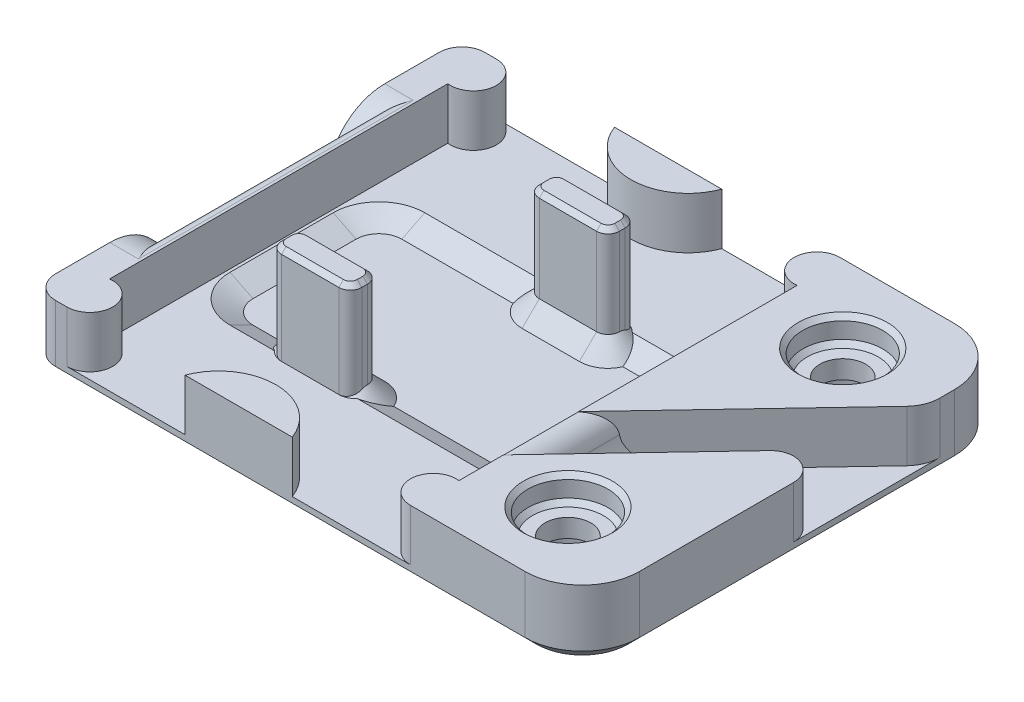
from build123d import *
from OCP.BRepFilletAPI import BRepFilletAPI_MakeChamfer

# Parameters (mm, degrees)
SKETCH2_W                       = 48
SKETCH2_H                       = 37.5
BOSS_EXTRUDE1_DEPTH             = 1.5
BOSS_EXTRUDE2_DEPTH             = 4.5
SKETCH4_W                       = 1.5
SKETCH4_H                       = 14
CUT_EXTRUDE1_DEPTH              = 36.882621142
SKETCH5_W                       = 14
SKETCH5_H                       = 1.349353752
CUT_EXTRUDE2_DEPTH              = 1
SKETCH6_R                       = 2
CUT_EXTRUDE3_DEPTH              = 36.882621142
FILLET1_R                       = 5
FILLET2_R                       = 2
FILLET3_R                       = 3
SKETCH7_W                       = 26
SKETCH7_H                       = 13
CUT_EXTRUDE4_DEPTH              = 1
FILLET4_R                       = 2
CHAMFER1_SIZE                   = 2
CHAMFER1_SIZE_2                 = 1
FILLET5_R                       = 1
CHAMFER3_SIZE                   = 1
BOSS_EXTRUDE3_REACH             = 37.883
SKETCH8_W                       = 7
SKETCH8_H                       = 2.5
BOSS_EXTRUDE3_DIRECTION_2_DEPTH = 4
FILLET6_R                       = 1
CHAMFER5_SIZE                   = 0.4
SKETCH9_R                       = 3.5
CUT_EXTRUDE5_DEPTH              = 2.2
CHAMFER6_SIZE                   = 0.4
SKETCH10_R                      = 4.5
CUT_EXTRUDE6_DEPTH              = 2.2


with BuildPart() as part:
    # Sketch2 → Boss-Extrude1 (new body)
    with BuildSketch(Plane(origin=(0, 0, 0), x_dir=(1, 0, 0), z_dir=(0, 1, 0))):
        with Locations((6, 0)):
            Rectangle(SKETCH2_W, SKETCH2_H)
    extrude(amount=-BOSS_EXTRUDE1_DEPTH)

    # Sketch3 → Boss-Extrude2 (add)
    with BuildSketch(Plane(origin=(0, 0, 0), x_dir=(1, 0, 0), z_dir=(0, 1, 0))):
        with BuildLine():
            Line((-4.683748499, -18.75), (4.683748499, -18.75))
            ThreePointArc((4.683748499, -18.75), (0, -15.5), (-4.683748499, -18.75))
        make_face()
        with BuildLine():
            Line((-18, 18.75), (-15, 18.75))
            ThreePointArc((-15, 18.75), (-13.003925482, 16.624754175), (-15.25, 14.765686517))
            Line((-15.25, 14.765686517), (-15.25, -14.765686517))
            ThreePointArc((-15.25, -14.765686517), (-13.003925482, -16.624754175), (-15, -18.75))
            Line((-15, -18.75), (-18, -18.75))
            Line((-18, -18.75), (-18, 18.75))
        make_face()
        with BuildLine():
            Line((15.25, 14.765686517), (15.25, -14.765686517))
            ThreePointArc((15.25, -14.765686517), (13.003925482, -16.624754175), (15, -18.75))
            Line((15, -18.75), (30, -18.75))
            Line((30, -18.75), (30, 4.724945092))
            Line((30, 4.724945092), (17, -9.025054908))
            Line((17, -9.025054908), (17, -2.474945092))
            Line((17, -2.474945092), (30, 11.275054908))
            Line((30, 11.275054908), (30, 18.75))
            Line((30, 18.75), (15, 18.75))
            ThreePointArc((15, 18.75), (13.003925482, 16.624754175), (15.25, 14.765686517))
        make_face()
        with BuildLine():
            Line((-4.683748499, 18.75), (4.683748499, 18.75))
            ThreePointArc((4.683748499, 18.75), (0, 15.5), (-4.683748499, 18.75))
        make_face()
    extrude(amount=BOSS_EXTRUDE2_DEPTH)

    # Sketch4 → Cut-Extrude1 (cut, through all)
    with BuildSketch(Plane(origin=(0, 4.5, 0), x_dir=(1, 0, 0), z_dir=(0, 1, 0))):
        with Locations((-17.25, 0)):
            Rectangle(SKETCH4_W, SKETCH4_H)
    extrude(amount=-CUT_EXTRUDE1_DEPTH, mode=Mode.SUBTRACT)

    # Sketch5 → Cut-Extrude2 (cut)
    with BuildSketch(Plane.ZY.offset(16.5)):
        with Locations((0, -0.825323124)):
            Rectangle(SKETCH5_W, SKETCH5_H)
    extrude(amount=-CUT_EXTRUDE2_DEPTH, mode=Mode.SUBTRACT)

    # Sketch6 → Cut-Extrude3 (cut, through all)
    with BuildSketch(Plane(origin=(0, 4.5, 0), x_dir=(1, 0, 0), z_dir=(0, 1, 0))):
        with Locations(Location((22, 12, 0), (0, 0, 270))):
            Circle(SKETCH6_R)
        with Locations(Location((22, -12, 0), (0, 0, 270))):
            Circle(SKETCH6_R)
    extrude(amount=-CUT_EXTRUDE3_DEPTH, mode=Mode.SUBTRACT)

    # Fillet1
    # the kernel refuses this fillet: 5 mm, written as the material it takes off along each edge
    with BuildSketch(Plane(origin=(-16.5, 4.5, 7), x_dir=(0, 0, 1), z_dir=(-1, 0, 0)), Plane(origin=(-30.5, 4.5, -7), x_dir=(0, 0, -1), z_dir=(1, 0, 0))) as fillet1_piece_1:
        with BuildLine():
            CenterArc((FILLET1_R, -FILLET1_R), FILLET1_R, 90, 90)
            Line((0, -FILLET1_R), (0, 0))
            Line((0, 0), (FILLET1_R, 0))
        make_face()
    extrude(amount=14, mode=Mode.SUBTRACT)
    with BuildSketch(Plane(origin=(-4, 4.5, 7), x_dir=(0, 0, 1), z_dir=(-1, 0, 0))) as fillet1_piece_2_section:
        with BuildLine():
            CenterArc((FILLET1_R, -FILLET1_R), FILLET1_R, 90, 90)
            Line((0, -FILLET1_R), (0, 0))
            Line((0, 0), (FILLET1_R, 0))
        make_face()
    fillet1_piece_2 = extrude(amount=26.5, mode=Mode.PRIVATE)
    fillet1_piece_2 = split(fillet1_piece_2, bisect_by=Plane(origin=(-15.5, 4.5, 7), z_dir=(-1, 0, 0)), keep=Keep.TOP, mode=Mode.PRIVATE)
    fillet1_piece_2 = split(fillet1_piece_2, bisect_by=Plane(origin=(-4, -0.150646248, 7), z_dir=(0, -1, 0)), keep=Keep.TOP, mode=Mode.PRIVATE)
    add(fillet1_piece_2, mode=Mode.SUBTRACT)
    with BuildSketch(Plane(origin=(30, 17, -18.75), x_dir=(-1, 0, 0), z_dir=(0, -1, 0)), Plane(origin=(30, 17, 18.75), x_dir=(0, 0, -1), z_dir=(0, -1, 0))) as fillet1_piece_3:
        with BuildLine():
            CenterArc((FILLET1_R, -FILLET1_R), FILLET1_R, 90, 90)
            Line((0, -FILLET1_R), (0, 0))
            Line((0, 0), (FILLET1_R, 0))
        make_face()
    extrude(amount=31, mode=Mode.SUBTRACT)
    with BuildSketch(Plane(origin=(-30.5, 4.5, -7), x_dir=(0, 0, -1), z_dir=(1, 0, 0))) as fillet1_piece_4_section:
        with BuildLine():
            CenterArc((FILLET1_R, -FILLET1_R), FILLET1_R, 90, 90)
            Line((0, -FILLET1_R), (0, 0))
            Line((0, 0), (FILLET1_R, 0))
        make_face()
    fillet1_piece_4 = extrude(amount=26.5, mode=Mode.PRIVATE)
    fillet1_piece_4 = split(fillet1_piece_4, bisect_by=Plane(origin=(-15.5, 4.5, -7), z_dir=(-1, 0, 0)), keep=Keep.TOP, mode=Mode.PRIVATE)
    fillet1_piece_4 = split(fillet1_piece_4, bisect_by=Plane(origin=(-30.5, -0.150646248, -7), z_dir=(0, -1, 0)), keep=Keep.TOP, mode=Mode.PRIVATE)
    add(fillet1_piece_4, mode=Mode.SUBTRACT)

    # Fillet2
    # the kernel refuses this fillet: 2 mm, written as the material it takes off along each edge
    with BuildSketch(Plane(origin=(30, 0, -4.724945092), x_dir=(0, 0, 1), z_dir=(0, 1, 0))) as fillet2_piece_1:
        with BuildLine():
            CenterArc((FILLET2_R * 2.51327226694, -FILLET2_R), FILLET2_R, 90, 136.606002989)
            Line((FILLET2_R * 1.82626088453, -FILLET2_R * 1.72664665447), (0, 0))
            Line((0, 0), (FILLET2_R * 2.51327226694, 0))
        make_face()
    extrude(amount=17.066361335, mode=Mode.SUBTRACT)
    with BuildSketch(Plane(origin=(17, 4.5, 14.025054908), x_dir=(0, -1, 0), z_dir=(0, 0, -1))) as fillet2_piece_2_section:
        with BuildLine():
            CenterArc((FILLET2_R, FILLET2_R), FILLET2_R, 180, 90)
            Line((0, FILLET2_R), (0, 0))
            Line((0, 0), (FILLET2_R, 0))
        make_face()
    fillet2_piece_2 = extrude(amount=16.550109817, mode=Mode.PRIVATE)
    fillet2_piece_2 = split(fillet2_piece_2, bisect_by=Plane(origin=(14.503927387, 4.5, 11.665131711), z_dir=(-0.7266466544661552, 0, -0.687011382404356)), keep=Keep.TOP, mode=Mode.PRIVATE)
    fillet2_piece_2 = split(fillet2_piece_2, bisect_by=Plane(origin=(11.234017442, 4.5, 8.57358049), z_dir=(0.7266466544661551, 0, 0.687011382404356)), keep=Keep.TOP, mode=Mode.PRIVATE)
    add(fillet2_piece_2, mode=Mode.SUBTRACT)
    with BuildSketch(Plane(origin=(-18, -6.5, -18.75), x_dir=(1, 0, 0), z_dir=(0, 1, 0))) as fillet2_piece_3:
        with BuildLine():
            CenterArc((FILLET2_R, -FILLET2_R), FILLET2_R, 90, 90)
            Line((0, -FILLET2_R), (0, 0))
            Line((0, 0), (FILLET2_R, 0))
        make_face()
    extrude(amount=16, mode=Mode.SUBTRACT)
    with BuildSketch(Plane(origin=(-18, -6.5, 18.75), x_dir=(1, 0, 0), z_dir=(0, 1, 0))) as fillet2_piece_4:
        with BuildLine():
            CenterArc((FILLET2_R, FILLET2_R), FILLET2_R, 180, 90)
            Line((0, FILLET2_R), (0, 0))
            Line((0, 0), (FILLET2_R, 0))
        make_face()
    extrude(amount=16, mode=Mode.SUBTRACT)

    # Fillet3
    fillet3_edges = [part.edges().sort_by_distance(p)[0] for p in [
        (17, 0, 5.75),
        (30, 2.25, -11.275054908),
    ]]
    fillet(fillet3_edges, radius=FILLET3_R)

    # Sketch7 → Cut-Extrude4 (cut)
    with BuildSketch(Plane(origin=(0, 0, 0), x_dir=(1, 0, 0), z_dir=(0, 1, 0))):
        Rectangle(SKETCH7_W, SKETCH7_H)
    extrude(amount=-CUT_EXTRUDE4_DEPTH, mode=Mode.SUBTRACT)

    # Fillet4
    fillet4_edges = [part.edges().sort_by_distance(p)[0] for p in [
        (-13, -0.5, 6.5),
        (-13, -0.5, -6.5),
        (13, -0.5, -6.5),
        (13, -0.5, 6.5),
    ]]
    fillet(fillet4_edges, radius=FILLET4_R)

    # Chamfer1
    chamfer1_edges_1 = [part.edges().sort_by_distance(p)[0] for p in [
        (12.414213562, 0, 5.914213562),
    ]]
    chamfer1_side_1 = [part.faces().sort_by_distance(p)[0] for p in [
        (12.428355698, 0, 5.928355698),
    ]]
    chamfer1_edges_2 = [part.edges().sort_by_distance(p)[0] for p in [
        (13, 0, 0),
    ]]
    chamfer1_side_2 = [part.faces().sort_by_distance(p)[0] for p in [
        (13.02, 0, 0),
    ]]
    chamfer1_edges_3 = [part.edges().sort_by_distance(p)[0] for p in [
        (12.414213562, 0, -5.914213562),
    ]]
    chamfer1_side_3 = [part.faces().sort_by_distance(p)[0] for p in [
        (12.428355698, 0, -5.928355698),
    ]]
    chamfer1_edges_4 = [part.edges().sort_by_distance(p)[0] for p in [
        (-12.414213562, 0, 5.914213562),
    ]]
    chamfer1_side_4 = [part.faces().sort_by_distance(p)[0] for p in [
        (-12.428355698, 0, 5.928355698),
    ]]
    chamfer1_edges_5 = [part.edges().sort_by_distance(p)[0] for p in [
        (-13, 0, 0),
    ]]
    chamfer1_side_5 = [part.faces().sort_by_distance(p)[0] for p in [
        (-13.02, 0, 0),
    ]]
    chamfer1_edges_6 = [part.edges().sort_by_distance(p)[0] for p in [
        (-12.414213562, 0, -5.914213562),
    ]]
    chamfer1_side_6 = [part.faces().sort_by_distance(p)[0] for p in [
        (-12.428355698, 0, -5.928355698),
    ]]
    chamfer1_edges_7 = [part.edges().sort_by_distance(p)[0] for p in [
        (0, 0, 6.5),
    ]]
    chamfer1_side_7 = [part.faces().sort_by_distance(p)[0] for p in [
        (0, 0, 6.52),
    ]]
    chamfer1_edges_8 = [part.edges().sort_by_distance(p)[0] for p in [
        (0, 0, -6.5),
    ]]
    chamfer1_side_8 = [part.faces().sort_by_distance(p)[0] for p in [
        (0, 0, -6.52),
    ]]
    chamfer1 = BRepFilletAPI_MakeChamfer(part.part.solid().wrapped)
    for e in chamfer1_edges_1:
        chamfer1.Add(CHAMFER1_SIZE - 0.0001, CHAMFER1_SIZE_2 - 0.0001, e.wrapped, chamfer1_side_1[0].wrapped)
    for e in chamfer1_edges_2:
        chamfer1.Add(CHAMFER1_SIZE - 0.0001, CHAMFER1_SIZE_2 - 0.0001, e.wrapped, chamfer1_side_2[0].wrapped)
    for e in chamfer1_edges_3:
        chamfer1.Add(CHAMFER1_SIZE - 0.0001, CHAMFER1_SIZE_2 - 0.0001, e.wrapped, chamfer1_side_3[0].wrapped)
    for e in chamfer1_edges_4:
        chamfer1.Add(CHAMFER1_SIZE - 0.0001, CHAMFER1_SIZE_2 - 0.0001, e.wrapped, chamfer1_side_4[0].wrapped)
    for e in chamfer1_edges_5:
        chamfer1.Add(CHAMFER1_SIZE - 0.0001, CHAMFER1_SIZE_2 - 0.0001, e.wrapped, chamfer1_side_5[0].wrapped)
    for e in chamfer1_edges_6:
        chamfer1.Add(CHAMFER1_SIZE - 0.0001, CHAMFER1_SIZE_2 - 0.0001, e.wrapped, chamfer1_side_6[0].wrapped)
    for e in chamfer1_edges_7:
        chamfer1.Add(CHAMFER1_SIZE - 0.0001, CHAMFER1_SIZE_2 - 0.0001, e.wrapped, chamfer1_side_7[0].wrapped)
    for e in chamfer1_edges_8:
        chamfer1.Add(CHAMFER1_SIZE - 0.0001, CHAMFER1_SIZE_2 - 0.0001, e.wrapped, chamfer1_side_8[0].wrapped)
    add(Compound.cast(chamfer1.Shape()), mode=Mode.REPLACE)  # a hair under: the kernel refuses the full size

    # Fillet5
    fillet5_edges = [part.edges().sort_by_distance(p)[0] for p in [
        (-16.5, 4.5, 0),
    ]]
    fillet(fillet5_edges, radius=FILLET5_R)

    # Chamfer3
    chamfer3_edges = [part.edges().sort_by_distance(p)[0] for p in [
        (-18, -1.5, -11.875),
        (-17.414213562, -1.5, -18.164213562),
        (4.5, -1.5, -18.75),
        (28.535533906, -1.5, -17.285533906),
        (-18, -1.5, 11.875),
        (30, -1.5, 0),
        (-17.414213562, -1.5, 18.164213562),
        (28.535533906, -1.5, 17.285533906),
        (4.5, -1.5, 18.75),
    ]]
    chamfer(chamfer3_edges, length=CHAMFER3_SIZE)

    # Sketch8 → Boss-Extrude3 (add, up to next)
    with BuildSketch(Plane(origin=(0, 4.5, 0), x_dir=(1, 0, 0), z_dir=(0, 1, 0)), mode=Mode.PRIVATE) as boss_extrude3_sk1:
        with Locations((3.5, 7.75)):
            Rectangle(SKETCH8_W, SKETCH8_H)
    boss_extrude3_tool1 = extrude(boss_extrude3_sk1.sketch, amount=-BOSS_EXTRUDE3_REACH, mode=Mode.PRIVATE) - part.part
    # Sketch8 → Boss-Extrude3 (add, up to next)
    with BuildSketch(Plane(origin=(0, 4.5, 0), x_dir=(1, 0, 0), z_dir=(0, 1, 0)), mode=Mode.PRIVATE) as boss_extrude3_sk2:
        with Locations((-3.5, -7.75)):
            Rectangle(SKETCH8_W, SKETCH8_H)
    boss_extrude3_tool2 = extrude(boss_extrude3_sk2.sketch, amount=-BOSS_EXTRUDE3_REACH, mode=Mode.PRIVATE) - part.part
    add(boss_extrude3_tool1.solids().sort_by_distance((3.5, 4.5, -7.75))[0])
    add(boss_extrude3_tool2.solids().sort_by_distance((-3.5, 4.5, 7.75))[0])

    # Sketch8 → Boss-Extrude3 direction 2 (add)
    with BuildSketch(Plane(origin=(0, 4.5, 0), x_dir=(1, 0, 0), z_dir=(0, 1, 0))):
        with Locations((3.5, 7.75)):
            Rectangle(SKETCH8_W, SKETCH8_H)
        with Locations((-3.5, -7.75)):
            Rectangle(SKETCH8_W, SKETCH8_H)
    extrude(amount=BOSS_EXTRUDE3_DIRECTION_2_DEPTH)

    # Fillet6
    fillet6_edges = [part.edges().sort_by_distance(p)[0] for p in [
        (0, 4.25, -9),
        (-7, 3.75005, 6.5),
        (0, 3.75005, -6.5),
        (7, 4.25, -9),
        (7, 3.75005, -6.5),
        (-7, 4.25, 9),
        (0, 3.75005, 6.5),
        (0, 4.25, 9),
    ]]
    fillet(fillet6_edges, radius=FILLET6_R)

    # Chamfer4: read off the stored shape, not the designer's step
    # Chamfer4: loft between two sections, ruled curve by curve
    chamfer4_from = [
        Edge.make_three_point_arc((1, 0.500000226, -6.500000226), (0.292893378, 0.500000226, -6.792893378), (2.26e-07, 0.500000226, -7.5)),
        Edge.make_three_point_arc((2.26e-07, 0.500000226, -7.5), (0.292893378, 0.500000226, -8.207106622), (1, 0.500000226, -8.499999774)),
        Edge.make_three_point_arc((6, 0.500001644, -8.499998356), (6.707105619, 0.500001644, -8.207105619), (6.999998356, 0.500001644, -7.5)),
        Edge.make_three_point_arc((6.999998356, 0.500001644, -7.5), (6.707105619, 0.500001644, -6.792894381), (6, 0.500001644, -6.500001644)),
        Edge.make_line((1, 0.500000226, -6.500000226), (6, 0.500001644, -6.500001644)),
        Edge.make_line((6, 0.500001644, -8.499998356), (1, 0.500000226, -8.499999774)),
    ]
    chamfer4_to = [
        Edge.make_three_point_arc((1, -1, -5), (-0.767766953, -1, -5.732233047), (-1.5, -1, -7.5)),
        Edge.make_three_point_arc((-1.5, -1, -7.5), (-0.767766953, -1, -9.267766953), (1, -1, -10)),
        Edge.make_three_point_arc((6, -1, -10), (7.767766953, -1, -9.267766953), (8.5, -1, -7.5)),
        Edge.make_three_point_arc((8.5, -1, -7.5), (7.767766953, -1, -5.732233047), (6, -1, -5)),
        Edge.make_line((1, -1, -5), (6, -1, -5)),
        Edge.make_line((6, -1, -10), (1, -1, -10)),
    ]
    chamfer4 = Solid(Shell([*[Face.make_surface_from_curves(chamfer4_from[k], chamfer4_to[k]) for k in range(6)], Face(Wire(chamfer4_from)), Face(Wire(chamfer4_to))]))
    add(chamfer4)

    # Chamfer4 2: loft between two sections, ruled curve by curve
    chamfer4_2_from = [
        Edge.make_three_point_arc((-1, 0.500000226, 6.500000226), (-0.292893378, 0.500000226, 6.792893378), (-2.26e-07, 0.500000226, 7.5)),
        Edge.make_three_point_arc((-2.26e-07, 0.500000226, 7.5), (-0.292893378, 0.500000226, 8.207106622), (-1, 0.500000226, 8.499999774)),
        Edge.make_three_point_arc((-6, 0.500001644, 8.499998356), (-6.707105619, 0.500001644, 8.207105619), (-6.999998356, 0.500001644, 7.5)),
        Edge.make_three_point_arc((-6.999998356, 0.500001644, 7.5), (-6.707105619, 0.500001644, 6.792894381), (-6, 0.500001644, 6.500001644)),
        Edge.make_line((-1, 0.500000226, 6.500000226), (-6, 0.500001644, 6.500001644)),
        Edge.make_line((-6, 0.500001644, 8.499998356), (-1, 0.500000226, 8.499999774)),
    ]
    chamfer4_2_to = [
        Edge.make_three_point_arc((-1, -1, 5), (0.767766953, -1, 5.732233047), (1.5, -1, 7.5)),
        Edge.make_three_point_arc((1.5, -1, 7.5), (0.767766953, -1, 9.267766953), (-1, -1, 10)),
        Edge.make_three_point_arc((-6, -1, 10), (-7.767766953, -1, 9.267766953), (-8.5, -1, 7.5)),
        Edge.make_three_point_arc((-8.5, -1, 7.5), (-7.767766953, -1, 5.732233047), (-6, -1, 5)),
        Edge.make_line((-1, -1, 5), (-6, -1, 5)),
        Edge.make_line((-6, -1, 10), (-1, -1, 10)),
    ]
    chamfer4_2 = Solid(Shell([*[Face.make_surface_from_curves(chamfer4_2_from[k], chamfer4_2_to[k]) for k in range(6)], Face(Wire(chamfer4_2_from)), Face(Wire(chamfer4_2_to))]))
    add(chamfer4_2)

    # Chamfer5
    chamfer5_edges = [part.edges().sort_by_distance(p)[0] for p in [
        (0, 8.5, -7.75),
        (3.5, 8.5, -9),
        (3.5, 8.5, -6.5),
        (7, 8.5, -7.75),
        (6.707106781, 8.5, -6.792893219),
        (0.292893219, 8.5, -6.792893219),
        (6.707106781, 8.5, -8.707106781),
        (0.292893219, 8.5, -8.707106781),
        (-3.5, 8.5, 9),
        (-7, 8.5, 7.75),
        (0, 8.5, 7.75),
        (-3.5, 8.5, 6.5),
        (-0.292893219, 8.5, 6.792893219),
        (-6.707106781, 8.5, 6.792893219),
        (-0.292893219, 8.5, 8.707106781),
        (-6.707106781, 8.5, 8.707106781),
    ]]
    chamfer(chamfer5_edges, length=CHAMFER5_SIZE)

    # Sketch9 → Cut-Extrude5 (cut)
    with BuildSketch(Plane(origin=(0, 4.5, 0), x_dir=(1, 0, 0), z_dir=(0, 1, 0))):
        with Locations(Location((22, 12, 0), (0, 0, 270))):
            Circle(SKETCH9_R)
        with Locations(Location((22, -12, 0), (0, 0, 270))):
            Circle(SKETCH9_R)
    extrude(amount=-CUT_EXTRUDE5_DEPTH, mode=Mode.SUBTRACT)

    # Chamfer6
    chamfer6_edges = [part.edges().sort_by_distance(p)[0] for p in [
        (22, 4.5, -15.5),
        (22, 2.3, -15.5),
        (22, 4.5, 8.5),
        (22, 2.3, 8.5),
    ]]
    chamfer(chamfer6_edges, length=CHAMFER6_SIZE)

    # Sketch10 → Cut-Extrude6 (cut)
    with BuildSketch(Plane.XZ.offset(1.5)):
        with Locations(Location((22, 12, 0), (0, 0, 270))):
            Circle(SKETCH10_R)
        with Locations(Location((22, -12, 0), (0, 0, 270))):
            Circle(SKETCH10_R)
    extrude(amount=-CUT_EXTRUDE6_DEPTH, mode=Mode.SUBTRACT)


solid = part.part
